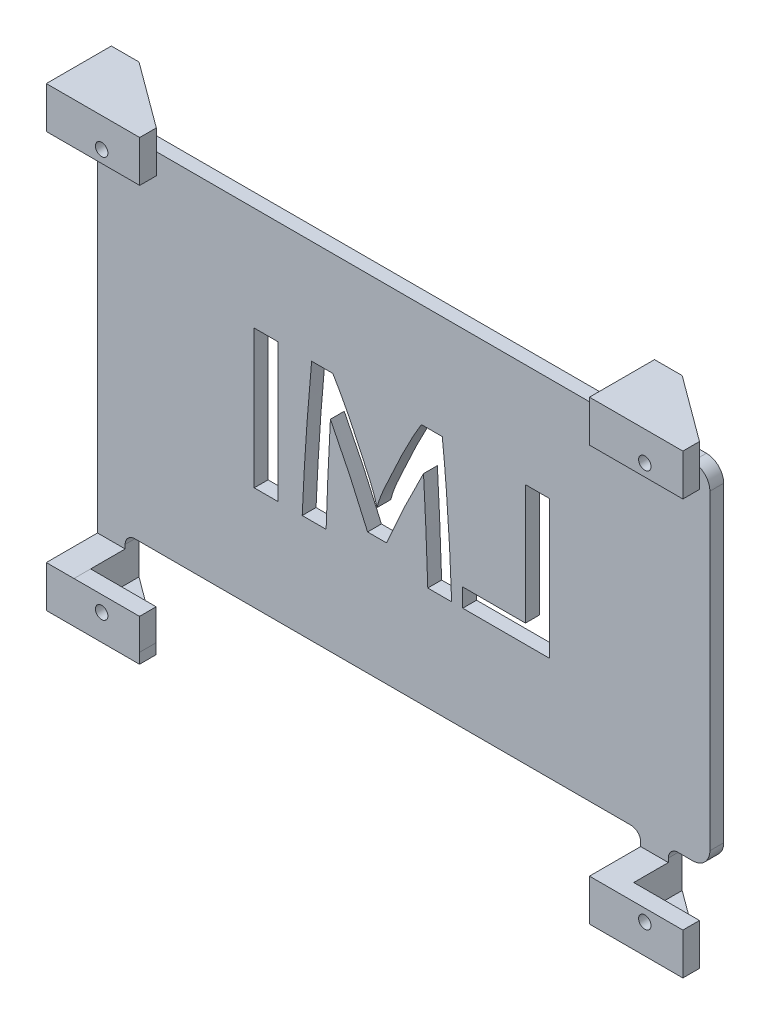
from build123d import *

# Parameters (mm, degrees)
SKETCH1_W              = 19
SKETCH1_H              = 9
SKETCH1_R              = 1.8
BOSS_EXTRUDE1_DEPTH    = 4.8
BOSS_EXTRUDE1_2_DEPTH  = 4.8
BOSS_EXTRUDE1_3_DEPTH  = 4.8
SKETCH1_W_2            = 18.947549714
BOSS_EXTRUDE1_4_DEPTH  = 4.8
BOSS_EXTRUDE2_DEPTH    = 4
BOSS_EXTRUDE3_DEPTH    = 8
BOSS_EXTRUDE4_DEPTH    = 8
FILLET1_R              = 2.8
SKETCH11_W             = 19
SKETCH11_H             = 4.8
BOSS_EXTRUDE5_DEPTH    = 3
BOSS_EXTRUDE6_DEPTH    = 3
LPATTERN1_COUNT        = 2
LPATTERN1_PITCH        = 157
CUT_EXTRUDE2_START     = -4
CUT_EXTRUDE2_OUTLINE_W = 6.933333333
CUT_EXTRUDE2_OUTLINE_H = 40
CUT_EXTRUDE2_DEPTH     = 4
SKETCH12_W             = 19
SKETCH12_H             = 4.8
BOSS_EXTRUDE7_DEPTH    = 3
SKETCH12_4_W           = 8
SKETCH12_4_H           = 18.8
BOSS_EXTRUDE9_DEPTH    = 3


# Read off the part's stored shape, not the designer's step: Cut-Extrude2
with BuildPart() as part:
    # Sketch1 → Boss-Extrude1 (new body)
    with BuildSketch(Plane.XY):
        with Locations((80, 58.45)):
            Rectangle(SKETCH1_W, SKETCH1_H)
        with Locations(Location((78.5, 57.45, 0), (0, 0, 180))):
            Circle(SKETCH1_R, mode=Mode.SUBTRACT)
    extrude(amount=-BOSS_EXTRUDE1_DEPTH)



with BuildPart() as body_2:
    # Sketch1 → Boss-Extrude1 2 (new body)
    with BuildSketch(Plane.XY):
        with Locations((80, -58.45)):
            Rectangle(SKETCH1_W, SKETCH1_H)
        with Locations((78.5, -57.45)):
            Circle(SKETCH1_R, mode=Mode.SUBTRACT)
    extrude(amount=-BOSS_EXTRUDE1_2_DEPTH)

    # Sketch12 → Boss-Extrude7 (add)
    with BuildSketch(Plane.XZ.offset(62.95)):
        Polygon((70.5, -4.8), (70.5, 0), (62.5, 0), (62.5, -18.8), (70.5, -18.8), align=None)
        Polygon((70.5, -18.8), (89.5, -4.8), (70.5, -4.8), align=None)
        with Locations((80, -2.4)):
            Rectangle(SKETCH12_W, SKETCH12_H)
        Polygon((-86.5, -18.8), (-67.552450286, -4.8), (-67.552450286, 0), (-94.5, 0), (-94.5, -18.8), align=None)
    extrude(amount=BOSS_EXTRUDE7_DEPTH)


with BuildPart() as body_3:
    # Sketch1 → Boss-Extrude1 3 (new body)
    with BuildSketch(Plane.XY):
        with Locations((-77, 58.45)):
            Rectangle(SKETCH1_W, SKETCH1_H)
        with Locations((-78.5, 57.45)):
            Circle(SKETCH1_R, mode=Mode.SUBTRACT)
    extrude(amount=-BOSS_EXTRUDE1_3_DEPTH)


with BuildPart() as body_4:
    # Sketch1 → Boss-Extrude1 4 (new body)
    with BuildSketch(Plane.XY):
        with Locations((-77.026225143, -58.448744181)):
            Rectangle(SKETCH1_W_2, SKETCH1_H)
        with Locations(Location((-78.5, -58.45, 0), (0, 0, 180))):
            Circle(SKETCH1_R, mode=Mode.SUBTRACT)
    extrude(amount=-BOSS_EXTRUDE1_4_DEPTH)


with BuildPart() as body_5:
    # Sketch3 → Boss-Extrude2 (new body)
    with BuildSketch(Plane(origin=(0, 0, -14.8), x_dir=(-1, 0, 0), z_dir=(0, 0, -1))):
        with BuildLine():
            Line((-77.5, -50), (82.5, -50))
            Line((82.5, -50), (86.5, -50))
            Line((86.5, -50), (86.5, 50))
            Line((86.5, 50), (82.5, 50))
            Line((82.5, 50), (-77.5, 50))
            ThreePointArc((-77.5, 50), (-81.035533906, 48.535533906), (-82.5, 45))
            Line((-82.5, 45), (-82.5, -45))
            ThreePointArc((-82.5, -45), (-81.035533906, -48.535533906), (-77.5, -50))
        make_face()
    extrude(amount=BOSS_EXTRUDE2_DEPTH)


with BuildPart() as part_1:
    add(part.part)

    add(body_5.part)  # Boss-Extrude3 merges body 5
    # Sketch4 → Boss-Extrude3 (add)
    with BuildSketch(Plane.ZY.offset(-70.5)):
        Polygon((-18.8, 61.95), (-18.8, 50), (-14.8, 50), (-14.8, 53.95), (0, 53.95), (0, 61.95), align=None)
    boss_extrude3 = extrude(amount=BOSS_EXTRUDE3_DEPTH)

    # Mirror4: Boss-Extrude3 across plane
    add(boss_extrude3.mirror(Plane.ZX))


    add(body_3.part)  # Boss-Extrude4 merges body 3

    add(body_4.part)  # Boss-Extrude4 merges body 4
    # Sketch10 → Boss-Extrude4 (add)
    with BuildSketch(Plane.ZY.offset(86.5)):
        Polygon((-14.8, 50), (-14.8, 26.95), (-14.8, -50), (-14.8, -53.95), (0, -53.95), (0, -61.95), (-18.8, -61.95), (-18.8, -50), (-18.8, 26.95), (-18.8, 50), (-18.8, 61.95), (0, 61.95), (0, 53.95), (-14.8, 53.95), align=None)
    extrude(amount=BOSS_EXTRUDE4_DEPTH)

    # Fillet1
    fillet1_edges = [part_1.edges().sort_by_distance(p)[0] for p in [
        (62.5, 50, -16.8),
        (70.5, 50, -16.8),
        (-86.5, 50, -16.8),
        (62.5, -50, -16.8),
        (-86.5, -50, -16.8),
        (70.5, -50, -16.8),
    ]]
    fillet(fillet1_edges, radius=FILLET1_R)

    # Sketch11 → Boss-Extrude5 (add)
    with BuildSketch(Plane(origin=(0, 62.95, 0), x_dir=(1, 0, 0), z_dir=(0, 1, 0))):
        with Locations((80, 2.4)):
            Rectangle(SKETCH11_W, SKETCH11_H)
        Polygon((89.5, 4.8), (70.5, 18.8), (70.5, 4.8), align=None)
    boss_extrude5 = extrude(amount=BOSS_EXTRUDE5_DEPTH)

    # Sketch11<5> → Boss-Extrude6 (add, symmetric)
    with BuildSketch(Plane(origin=(0, 62.95, 0), x_dir=(1, 0, 0), z_dir=(0, 1, 0))):
        Polygon((62.5, 18.8), (62.5, 0), (70.5, 0), (70.5, 4.8), (70.5, 18.8), align=None)
    boss_extrude6 = extrude(amount=BOSS_EXTRUDE6_DEPTH, both=True)

    # LPattern1: Boss-Extrude5, Boss-Extrude6 ×2
    with Locations(*[(-i * LPATTERN1_PITCH, 0, 0) for i in range(1, LPATTERN1_COUNT)]):
        add(boss_extrude5)
        add(boss_extrude6)

    # Cut-Extrude2 outline → Cut-Extrude2 (cut)
    with BuildSketch(Plane(origin=(0, 0, -18.8), x_dir=(-1, 0, 0), z_dir=(0, 0, -1)).offset(CUT_EXTRUDE2_START)):
        with BuildLine():
            add(Edge.make_bspline(
                [(10.975, -14.666666667), (10.853422825, -14.380277897), (10.602565639, -13.789355455), (10.2019734, -12.881204225), (9.767405766, -11.924663917), (9.307519179, -10.914258143), (8.824913039, -9.84726331), (8.314703241, -8.72434694), (7.79171958, -7.538855775), (7.060810636, -5.888109041), (6.129555226, -3.804410061), (4.927921427, -1.367968701), (3.745344455, 1.001863959), (2.800332488, 2.930787983), (2.085444913, 4.420434389), (1.562508134, 5.460457627), (1.061997748, 6.444961947), (0.646894723, 7.213714992), (0.390028809, 7.741258394), (0.294400491, 7.960576425), (0.265045842, 8.033579646)],
                knots=[0, 0, 0, 0, 0.034500563, 0.071187, 0.110063316, 0.15100446, 0.194290954, 0.239922853, 0.287774458, 0.337971758, 0.440120704, 0.540825287, 0.639182399, 0.733823363, 0.779010204, 0.822402877, 0.862904814, 0.901482229, 0.919254697, 0.927976768, 0.927976768, 0.927976768, 0.927976768], degree=3))
            Line((10.975, -14.666666667), (16.433333333, -14.666666667))
            add(Edge.make_bspline(
                [(27.185837823, 8.182370431), (27.16617885, 8.135201447), (27.077190149, 7.929706006), (26.638721231, 7.048600418), (25.829878755, 5.497567499), (24.783516915, 3.316615567), (23.677292972, 1.061322281), (22.496472017, -1.232864568), (21.307452474, -3.637070323), (20.375347087, -5.74013551), (19.642877201, -7.45328115), (19.114948929, -8.684692719), (18.595469257, -9.83506941), (18.101022183, -10.910308731), (17.641251792, -11.924811954), (17.206280513, -12.881167962), (16.805785724, -13.789363687), (16.554916393, -14.380280585), (16.433333333, -14.666666667)],
                knots=[0.069075624, 0.069075624, 0.069075624, 0.069075624, 0.074722211, 0.093815852, 0.177875914, 0.268118698, 0.361243693, 0.455604817, 0.553401566, 0.65774291, 0.709886229, 0.759408515, 0.805872658, 0.849438848, 0.8902598, 0.929021986, 0.965600721, 1, 1, 1, 1], degree=3))
            add(Edge.make_bspline(
                [(28.416666667, -20), (28.370326707, -18.622190652), (28.278576595, -15.894217539), (28.126835921, -11.841493191), (27.972919305, -7.871719916), (27.793529228, -4.002689262), (27.621652056, -0.271985015), (27.446461619, 3.283575307), (27.301676648, 6.080429142), (27.213112404, 7.691042727), (27.185837823, 8.182370431)],
                knots=[0, 0, 0, 0, 0.138334797, 0.273893922, 0.406956967, 0.536980294, 0.66254851, 0.781713115, 0.894196585, 0.943574943, 0.943574943, 0.943574943, 0.943574943], degree=3))
            Line((28.416666667, -20), (35.333333333, -20))
            add(Edge.make_bspline(
                [(32.608333333, 20), (32.900086832, 16.750700945), (33.488285429, 10.199851855), (34.22240543, 0.281966095), (34.854498798, -9.801801427), (35.172888466, -16.58285171), (35.333333333, -20)],
                knots=[0, 0, 0, 0, 0.244084907, 0.492094869, 0.744053343, 1, 1, 1, 1], degree=3))
            Line((32.608333333, 20), (26.5, 20))
            add(Edge.make_bspline(
                [(13.708333333, -7.2), (13.830007974, -6.723206803), (14.084227403, -5.727024743), (14.60790834, -4.202590997), (15.228118515, -2.563650948), (16.267159704, -0.227490136), (17.691281094, 2.819546572), (19.414993101, 6.558422585), (21.178315261, 10.255040247), (22.694244718, 13.223986219), (23.88002457, 15.483108195), (24.769643789, 17.058555357), (25.620362017, 18.56810669), (26.210964283, 19.529501548), (26.5, 20)],
                knots=[0, 0, 0, 0, 0.048991334, 0.102359448, 0.160419925, 0.223485875, 0.356930682, 0.495438602, 0.633536698, 0.764814667, 0.827438497, 0.887631747, 0.945007934, 1, 1, 1, 1], degree=3))
            add(Edge.make_bspline(
                [(0.875, 20), (1.488654305, 18.979646564), (2.747485512, 16.886525506), (4.528875905, 13.57233268), (6.317629783, 10.03594448), (8.05073889, 6.322134495), (9.762822193, 2.612044415), (11.165454408, -0.380308514), (12.190165242, -2.648246106), (12.811441851, -4.240209855), (13.334558303, -5.740131954), (13.586944811, -6.725888004), (13.708333333, -7.2)],
                knots=[0, 0, 0, 0, 0.118514609, 0.243117155, 0.374451296, 0.51299163, 0.651063123, 0.781216145, 0.842002695, 0.898745008, 0.951300115, 1, 1, 1, 1], degree=3))
            Line((0.875, 20), (-5.15, 20))
            add(Edge.make_bspline(
                [(-7.866666667, -20), (-7.793061043, -18.169390935), (-7.648961945, -14.585573542), (-7.412691767, -9.29864876), (-7.122844657, -4.171204641), (-6.81303939, 0.843509011), (-6.445549688, 5.747929795), (-6.081795853, 10.555682601), (-5.642721893, 15.291472548), (-5.314200688, 18.430872547), (-5.15, 20)],
                knots=[0, 0, 0, 0, 0.137063101, 0.268330979, 0.395915623, 0.521267524, 0.644201892, 0.763852071, 0.881969103, 1, 1, 1, 1], degree=3))
            Line((-7.866666667, -20), (-0.966666667, -20))
            add(Edge.make_bspline(
                [(0.265045842, 8.033579646), (0.240657124, 7.594605286), (0.154028006, 6.039024937), (-0.000810917, 3.297839119), (-0.167059263, -0.255673004), (-0.358502841, -3.988239018), (-0.518551576, -7.860926765), (-0.678215675, -11.835877361), (-0.828073098, -15.891460777), (-0.92018915, -18.622196537), (-0.966666667, -20)],
                knots=[0.061407132, 0.061407132, 0.061407132, 0.061407132, 0.105523386, 0.217741555, 0.336904218, 0.462483689, 0.592771123, 0.725832, 0.861667458, 1, 1, 1, 1], degree=3))
        make_face()
        with Locations((45.733333333, 0)):
            Rectangle(CUT_EXTRUDE2_OUTLINE_W, CUT_EXTRUDE2_OUTLINE_H)
        Polygon((-29.2, 20), (-36.133333333, 20), (-36.133333333, -20), (-11.066666667, -20), (-11.066666667, -14.666666667), (-29.2, -14.666666667), align=None)
    extrude(amount=CUT_EXTRUDE2_DEPTH, mode=Mode.SUBTRACT)



with BuildPart() as boss_extrude7_piece_1:
    # of the separate pieces the step leaves, piece 1, a body of its own (boss_extrude7_pieces)
    add(body_2.part.solids().sort_by_distance((89.5, -53.95, 0))[0])


with BuildPart() as boss_extrude7_piece_2:
    # of the separate pieces the step leaves, piece 2, a body of its own (boss_extrude7_pieces)
    add(body_2.part.solids().sort_by_distance((-86.5, -62.95, -18.8))[0])


with BuildPart() as part_2:
    add(part_1.part)

    add(boss_extrude7_piece_1.part)  # Boss-Extrude9 merges Boss-Extrude7 piece 1

    add(boss_extrude7_piece_2.part)  # Boss-Extrude9 merges Boss-Extrude7 piece 2
    # Sketch12<4> → Boss-Extrude9 (add)
    with BuildSketch(Plane.XZ.offset(62.95)):
        with Locations((-90.5, -9.4)):
            Rectangle(SKETCH12_4_W, SKETCH12_4_H)
        Polygon((70.5, -4.8), (70.5, 0), (62.5, 0), (62.5, -18.8), (70.5, -18.8), align=None)
    extrude(amount=-BOSS_EXTRUDE9_DEPTH)


solid = part_2.part
